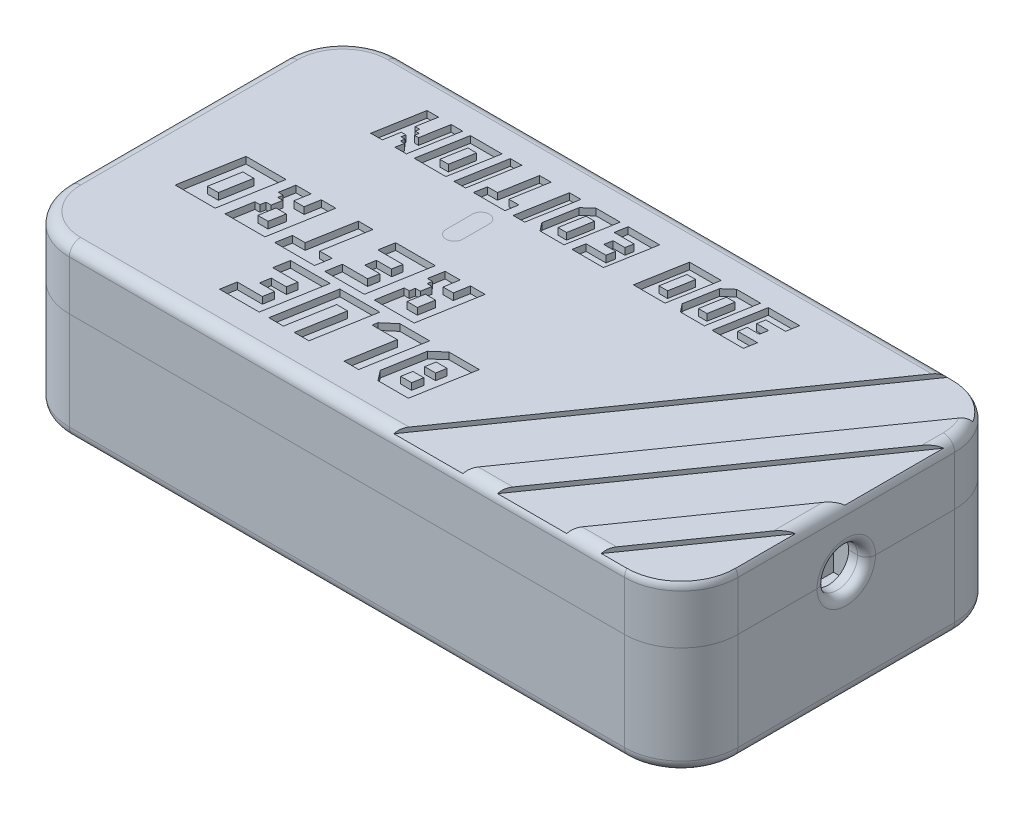
from build123d import *

# Parameters (mm, degrees)
SKETCH1_R                                  = 2
BOSS_EXTRUDE1_DEPTH                        = 0.8
SKETCH2_W                                  = 1.500000048
SKETCH2_H                                  = 4.000000128
BOSS_EXTRUDE2_DEPTH                        = 1
SKETCH3_W                                  = 48.25
SKETCH3_H                                  = 25.72
BOSS_EXTRUDE3_DEPTH                        = 4.15
SKETCH4_W                                  = 4.999999906
SKETCH4_H                                  = 2.000000064
CUT_EXTRUDE1_DEPTH                         = 0.1
SKETCH9_W                                  = 17.77
SKETCH9_H                                  = 15.77
BOSS_EXTRUDE8_DEPTH                        = 3.2
SKETCH23_W                                 = 6.24
SKETCH23_H                                 = 19.54
BOSS_EXTRUDE14_DEPTH                       = 3.32
BOX_SHAPE_DEPTH                            = 6.7945
BOX_SHAPE_DEPTH_BACK                       = 12.250000074
SKETCH5_W                                  = 74.9375
SKETCH5_H                                  = 37.000000128
CORNER_FILLETS_R                           = 6.35
TOP_SHELL_T                                = -2
BOTTOM_SHELL_T                             = -2
PCB_BOSS_HORIZONTAL_DEPTH                  = 1
PCB_BOSS_HORIZONTAL_2_DEPTH                = 1
PCB_BOSS_VERT_PATTERN_1_COUNT              = 2
PCB_BOSS_VERT_PATTERN_1_ANGLE              = 90
PCB_BOSS_VERT_PATTERN_2_COUNT              = 2
PCB_BOSS_VERT_PATTERN_2_ANGLE              = 90
SKETCH7_R                                  = 2.45
SKETCH7_R_2                                = 1.95
PCB_BOSS_EDGE_BREAK_DEPTH                  = 80.071052961
PCB_PCB_TOP_CATCH_REACH                    = 81.319
SKETCH8_R                                  = 3
SKETCH8_R_2                                = 2
BOSS_NOTCH_FOR_ESP32_REACH                 = 79.988
SKETCH10_W                                 = 3.175
SKETCH10_H                                 = 6.35
SHORT_SIDE_SNAP_FIT_FEMALE_DEPTH           = 11.5
SNAP_FIT_FILL_FOR_CORD_HOLE_REACH          = 82.987
SKETCH24_W                                 = 6.35
SKETCH24_H                                 = 3.7011433
LONG_SIDE_SNP_FIT_FEMALE_DEPTH             = 30.46875
SHORT_SIDE_SNAP_FIT_MALE_DEPTH             = 10.5
SHORT_SIDE_SNAP_FIT_MALE_DEPTH_BACK        = 10.5
LONG_SIDE_SNP_FIT_MALE_DEPTH               = 29.46875
LONG_SIDE_SNP_FIT_MALE_DEPTH_BACK          = 29.46875
SKETCH15_R                                 = 2.275
CORD_HOLE_CUT_DEPTH                        = 2
SNAPFIT_MALE_REMOVAL_FOR_CORD_HOLE_1_REACH = 81.191
SKETCH25_W                                 = 8.35
SKETCH25_H                                 = 7.7945
SKETCH26_W                                 = 8.35
SKETCH26_H                                 = 2.95
SNAPFIT_MALE_REMOVAL_FOR_CORD_HOLE_2_DEPTH = 81.987291698
CORD_HOLE_FILLET_BOTTOM_R                  = 1
CORD_HOLE_FILLET_TOP_R                     = 1
LED_HOLE_DEPTH                             = 2
TOP_EDGE_FILLET_R                          = 1.27
DIAG_LINES_CUT_DEPTH                       = 0.5
TEXT_CUT_DEPTH                             = 0.75
BOTTOM_EDGE_FILLET_R                       = 1.27
LED_DIFFUSER_MOCK_DEPTH                    = 1


with BuildPart() as part:
    # Sketch1 → Boss-Extrude1 (new, symmetric)
    with BuildSketch(Plane(origin=(0, 0, 0), x_dir=(1, 0, 0), z_dir=(0, 1, 0))):
        with BuildLine():
            Line((2, 0), (61, 0))
            ThreePointArc((61, 0), (62.414213562, 0.585786438), (63, 2))
            Line((63, 2), (63, 27))
            ThreePointArc((63, 27), (62.414213562, 28.414213562), (61, 29))
            Line((61, 29), (2, 29))
            ThreePointArc((2, 29), (0.585786438, 28.414213562), (0, 27))
            Line((0, 27), (0, 2))
            ThreePointArc((0, 2), (0.585786438, 0.585786438), (2, 0))
        make_face()
        with Locations(Location((4, 4, 0), (0, 0, 270))):
            Circle(SKETCH1_R, mode=Mode.SUBTRACT)
        with Locations(Location((4, 25, 0), (0, 0, 270))):
            Circle(SKETCH1_R, mode=Mode.SUBTRACT)
        with Locations(Location((59, 25, 0), (0, 0, 270))):
            Circle(SKETCH1_R, mode=Mode.SUBTRACT)
        with Locations(Location((59, 4, 0), (0, 0, 270))):
            Circle(SKETCH1_R, mode=Mode.SUBTRACT)
    extrude(amount=BOSS_EXTRUDE1_DEPTH, both=True)

    # Sketch2 → Boss-Extrude2 (add)
    with BuildSketch(Plane(origin=(0, 0.8, 0), x_dir=(1, 0, 0), z_dir=(0, 1, 0))):
        with Locations((23, 20)):
            Rectangle(SKETCH2_W, SKETCH2_H)
    extrude(amount=BOSS_EXTRUDE2_DEPTH)

    # Sketch3 → Boss-Extrude3 (add)
    with BuildSketch(Plane.XZ.offset(0.8)):
        with Locations((31, -15)):
            Rectangle(SKETCH3_W, SKETCH3_H)
    extrude(amount=BOSS_EXTRUDE3_DEPTH)

    # Sketch4 → Cut-Extrude1 (cut)
    with BuildSketch(Plane(origin=(0, 0.8, 0), x_dir=(1, 0, 0), z_dir=(0, 1, 0))):
        with Locations((52, 23)):
            Rectangle(SKETCH4_W, SKETCH4_H)
        with Locations((52, 13)):
            Rectangle(SKETCH4_W, SKETCH4_H)
        with Locations((52, 18)):
            Rectangle(SKETCH4_W, SKETCH4_H)
        with Locations((52, 8)):
            Rectangle(SKETCH4_W, SKETCH4_H)
    extrude(amount=-CUT_EXTRUDE1_DEPTH, mode=Mode.SUBTRACT)

    # Sketch9 → Boss-Extrude8 (add)
    with BuildSketch(Plane.XZ.offset(4.95)):
        with Locations((22.76, -15)):
            Rectangle(SKETCH9_W, SKETCH9_H)
    extrude(amount=BOSS_EXTRUDE8_DEPTH)

    # Sketch23 → Boss-Extrude14 (add)
    with BuildSketch(Plane(origin=(0, 0.8, 0), x_dir=(1, 0, 0), z_dir=(0, 1, 0))):
        with Locations((31, 15)):
            Rectangle(SKETCH23_W, SKETCH23_H)
        with Locations((43, 15)):
            Rectangle(SKETCH23_W, SKETCH23_H)
    extrude(amount=BOSS_EXTRUDE14_DEPTH)


with BuildPart() as body_2:
    # Sketch5 → Box Shape (new, two sides: drawn at the far end of the back side and taken through both)
    with BuildSketch(Plane(origin=(0, 0, 0), x_dir=(1, 0, 0), z_dir=(0, 1, 0)).offset(-BOX_SHAPE_DEPTH_BACK)):
        with Locations((33.46875, 14.500000064)):
            Rectangle(SKETCH5_W, SKETCH5_H)
    extrude(amount=BOX_SHAPE_DEPTH + BOX_SHAPE_DEPTH_BACK)

    # Corner Fillets
    corner_fillets_edges = [body_2.edges().sort_by_distance(p)[0] for p in [
        (-4, -2.727750037, -33.000000128),
        (70.9375, -2.727750037, -33.000000128),
        (70.9375, -2.727750037, 4),
        (-4, -2.727750037, 4),
    ]]
    fillet(corner_fillets_edges, radius=CORNER_FILLETS_R)


with BuildPart() as body_3:
    # Top Bottom Split: the piece on the far side of the plane
    add(body_2.part)
    split(bisect_by=Plane.ZX, keep=Keep.BOTTOM)

    # Bottom Shell
    bottom_shell_openings = [body_3.faces().sort_by_distance(p)[0] for p in [
        (33.46875, 0, -14.500000064),
    ]]
    offset(amount=BOTTOM_SHELL_T, openings=bottom_shell_openings, kind=Kind.INTERSECTION)


with BuildPart() as body_2_1:
    add(body_2.part)

    # Top Bottom Split
    split(bisect_by=Plane.ZX, keep=Keep.TOP)

    # Top Shell
    top_shell_openings = [body_2_1.faces().sort_by_distance(p)[0] for p in [
        (33.46875, 0, -14.500000064),
    ]]
    offset(amount=TOP_SHELL_T, openings=top_shell_openings, kind=Kind.INTERSECTION)


with BuildPart() as body_4:
    # Sketch6 → PCB Boss Horizontal (new, symmetric)
    with BuildSketch(Plane.XY.offset(-4.000000128)):
        Polygon((61.75, -0.8), (64.715, -10.250000074), (53.285, -10.250000074), (56.25, -0.8), (57.25, -0.8), (57.25, 3.7945), (60.75, 3.7945), (60.75, -0.8), align=None)
    extrude(amount=PCB_BOSS_HORIZONTAL_DEPTH, both=True)


with BuildPart() as body_5:
    # Sketch6 → PCB Boss Horizontal 2 (new, symmetric)
    with BuildSketch(Plane.XY.offset(-4.000000128)):
        Polygon((2.25, -0.8), (1.25, -0.8), (-1.715, -10.250000074), (9.715, -10.250000074), (6.75, -0.8), (5.75, -0.8), (5.75, 3.7945), (2.25, 3.7945), align=None)
    extrude(amount=PCB_BOSS_HORIZONTAL_2_DEPTH, both=True)


with BuildPart() as pcb_boss_vert_pattern_1_1:
    # PCB Boss Vert Pattern 1: pattern copy
    add(body_4.part.rotate(Axis((59, 0, -4), (0, 1, 0)), 1 * PCB_BOSS_VERT_PATTERN_1_ANGLE / (PCB_BOSS_VERT_PATTERN_1_COUNT - 1)))


with BuildPart() as pcb_boss_vert_pattern_2_1:
    # PCB Boss Vert Pattern 2: pattern copy
    add(body_5.part.rotate(Axis((4, 0, -4), (0, 1, 0)), 1 * PCB_BOSS_VERT_PATTERN_2_ANGLE / (PCB_BOSS_VERT_PATTERN_2_COUNT - 1)))


with BuildPart() as body_8:
    # PCB Boss Mirror 1: read off the stored shape, not the designer's step
    # PCB Boss Mirror 1: mirrored copy
    add(pcb_boss_vert_pattern_2_1.part.mirror(Plane.XY.offset(-14.5)))


with BuildPart() as body_9:
    # PCB Boss Mirror 1 2: mirrored copy
    add(body_5.part.mirror(Plane.XY.offset(-14.5)))


with BuildPart() as body_10:
    # PCB Boss Mirror 2: mirrored copy
    add(body_4.part.mirror(Plane(origin=(0, 0, -14.5), x_dir=(1, 0, 0), z_dir=(0, 0, -1))))


with BuildPart() as body_11:
    # PCB Boss Mirror 2 2: mirrored copy
    add(pcb_boss_vert_pattern_1_1.part.mirror(Plane(origin=(0, 0, -14.5), x_dir=(1, 0, 0), z_dir=(0, 0, -1))))


with BuildPart() as body_4_1:
    add(body_4.part)

    # Bottom Combine: union body 5, PCB Boss Vert Pattern 2_1, PCB Boss Vert Pattern 1_1, body 3, body 9, body 8, body 11, body 10
    add(body_5.part)
    add(pcb_boss_vert_pattern_2_1.part)
    add(pcb_boss_vert_pattern_1_1.part)
    add(body_3.part)
    add(body_9.part)
    add(body_8.part)
    add(body_11.part)
    add(body_10.part)

    # Sketch7 → PCB Boss Edge Break (cut, through all)
    # profile 1 of 4: a face of its own
    with BuildSketch(Plane(origin=(0, -0.8, 0), x_dir=(1, 0, 0), z_dir=(0, 1, 0))):
        with Locations((59, 25)):
            Circle(SKETCH7_R)
        with Locations((59, 25)):
            Circle(SKETCH7_R_2, mode=Mode.SUBTRACT)
    # profile 2 of 4: a face of its own
    with BuildSketch(Plane(origin=(0, -0.8, 0), x_dir=(1, 0, 0), z_dir=(0, 1, 0))):
        with Locations((59, 4)):
            Circle(SKETCH7_R)
        with Locations((59, 4)):
            Circle(SKETCH7_R_2, mode=Mode.SUBTRACT)
    # profile 3 of 4: a face of its own
    with BuildSketch(Plane(origin=(0, -0.8, 0), x_dir=(1, 0, 0), z_dir=(0, 1, 0))):
        with Locations((4, 4)):
            Circle(SKETCH7_R)
        with Locations((4, 4)):
            Circle(SKETCH7_R_2, mode=Mode.SUBTRACT)
    # profile 4 of 4: a face of its own
    with BuildSketch(Plane(origin=(0, -0.8, 0), x_dir=(1, 0, 0), z_dir=(0, 1, 0))):
        with Locations((4, 25)):
            Circle(SKETCH7_R)
        with Locations((4, 25)):
            Circle(SKETCH7_R_2, mode=Mode.SUBTRACT)
    extrude(amount=PCB_BOSS_EDGE_BREAK_DEPTH, mode=Mode.SUBTRACT)

    # Boss Notch for ESP32: up to this face of the body (flat: up to its plane)
    boss_notch_for_esp32_end = Plane(body_4_1.part.faces().sort_by_distance((6.601382843, -5.53442938, -25.999999872))[0])
    # Sketch10 → Boss Notch for ESP32 (cut, up to the picked face)
    with BuildSketch(Plane.XY.offset(-3.000000128), mode=Mode.PRIVATE) as boss_notch_for_esp32_sk1:
        with Locations((54.5375, -2.775)):
            Rectangle(SKETCH10_W, SKETCH10_H)
    boss_notch_for_esp32_tool1 = split(extrude(boss_notch_for_esp32_sk1.sketch, amount=-BOSS_NOTCH_FOR_ESP32_REACH, mode=Mode.PRIVATE), bisect_by=boss_notch_for_esp32_end, keep=Keep.BOTH, mode=Mode.PRIVATE)
    # Sketch10 → Boss Notch for ESP32 (cut, up to the picked face)
    with BuildSketch(Plane.XY.offset(-3.000000128), mode=Mode.PRIVATE) as boss_notch_for_esp32_sk2:
        with Locations((7.4625, -2.775)):
            Rectangle(SKETCH10_W, SKETCH10_H)
    boss_notch_for_esp32_tool2 = split(extrude(boss_notch_for_esp32_sk2.sketch, amount=-BOSS_NOTCH_FOR_ESP32_REACH, mode=Mode.PRIVATE), bisect_by=boss_notch_for_esp32_end, keep=Keep.BOTH, mode=Mode.PRIVATE)
    add(boss_notch_for_esp32_tool1.solids().sort_by(Axis((54.5375, -2.775, -3), (0, 0, -1)))[0], mode=Mode.SUBTRACT)
    add(boss_notch_for_esp32_tool2.solids().sort_by(Axis((7.4625, -2.775, -3), (0, 0, -1)))[0], mode=Mode.SUBTRACT)

    # Sketch11 → Short Side Snap Fit Female (cut, symmetric)
    with BuildSketch(Plane(origin=(0, 0, -14.500000064), x_dir=(-1, 0, 0), z_dir=(0, 0, -1))):
        with BuildLine():
            Line((-68.9375, 0), (-68.9375, -3))
            Line((-68.9375, -3), (-69.1875, -3))
            ThreePointArc((-69.1875, -3), (-69.937242994, -2.269632711), (-69.226751967, -1.501027849))
            Line((-69.226751967, -1.501027849), (-69.305417503, 0))
            Line((-69.305417503, 0), (-68.9375, 0))
        make_face()
    short_side_snap_fit_female = extrude(amount=SHORT_SIDE_SNAP_FIT_FEMALE_DEPTH, both=True, mode=Mode.SUBTRACT)

    # Snap Fit Fill for Cord Hole: up to this face of the body (flat: up to its plane)
    snap_fit_fill_for_cord_hole_end = Plane(body_4_1.part.faces().sort_by_distance((70.9375, -6.125000037, -14.500000064))[0])
    # Sketch24 → Snap Fit Fill for Cord Hole (add, up to the picked face)
    with BuildSketch(Plane.ZY.offset(-68.9375), mode=Mode.PRIVATE) as snap_fit_fill_for_cord_hole_sk1:
        with Locations((-14.500000064, -1.85057165)):
            Rectangle(SKETCH24_W, SKETCH24_H)
    snap_fit_fill_for_cord_hole_tool1 = split(extrude(snap_fit_fill_for_cord_hole_sk1.sketch, amount=-SNAP_FIT_FILL_FOR_CORD_HOLE_REACH, mode=Mode.PRIVATE), bisect_by=snap_fit_fill_for_cord_hole_end, keep=Keep.BOTH, mode=Mode.PRIVATE)
    add(snap_fit_fill_for_cord_hole_tool1.solids().sort_by(Axis((68.9375, -1.850572, -14.5), (1, 0, 0)))[0])

    # Short Side Snp Fit Female Mirror: Short Side Snap Fit Female across plane
    add(short_side_snap_fit_female.mirror(Plane.ZY.offset(-33.46875)), mode=Mode.SUBTRACT)

    # Sketch12 → Long Side Snp Fit Female (cut, symmetric)
    with BuildSketch(Plane.ZY.offset(-33.46875)):
        with BuildLine():
            Line((2.367449648, 0), (2, 0))
            Line((2, 0), (2, -3))
            Line((2, -3), (2.25, -3))
            ThreePointArc((2.25, -3), (2.999749072, -2.269399183), (2.288785386, -1.501003542))
            Line((2.288785386, -1.501003542), (2.367449648, 0))
        make_face()
    long_side_snp_fit_female = extrude(amount=LONG_SIDE_SNP_FIT_FEMALE_DEPTH, both=True, mode=Mode.SUBTRACT)

    # Long Side Snp Fit Female Mirror: Long Side Snp Fit Female across plane
    add(long_side_snp_fit_female.mirror(Plane(origin=(0, 0, -14.500000064), x_dir=(1, 0, 0), z_dir=(0, 0, -1))), mode=Mode.SUBTRACT)


with BuildPart() as body_4_2:

    # Sketch8 → PCB PCB Top Catch (new, up to next)
    with BuildSketch(Plane(origin=(0, 0.8, 0), x_dir=(1, 0, 0), z_dir=(0, 1, 0)), mode=Mode.PRIVATE) as pcb_pcb_top_catch_sk1:
        with Locations(Location((59, 4, 0), (0, 0, 90))):
            Circle(SKETCH8_R)
        with Locations(Location((59, 4, 0), (0, 0, 270))):
            Circle(SKETCH8_R_2, mode=Mode.SUBTRACT)
    pcb_pcb_top_catch_tool1 = extrude(pcb_pcb_top_catch_sk1.sketch, amount=PCB_PCB_TOP_CATCH_REACH, mode=Mode.PRIVATE) - body_2_1.part
    # Sketch8 → PCB PCB Top Catch (new, up to next)
    with BuildSketch(Plane(origin=(0, 0.8, 0), x_dir=(1, 0, 0), z_dir=(0, 1, 0)), mode=Mode.PRIVATE) as pcb_pcb_top_catch_sk2:
        with Locations(Location((59, 25, 0), (0, 0, 90))):
            Circle(SKETCH8_R)
        with Locations(Location((59, 25, 0), (0, 0, 270))):
            Circle(SKETCH8_R_2, mode=Mode.SUBTRACT)
    pcb_pcb_top_catch_tool2 = extrude(pcb_pcb_top_catch_sk2.sketch, amount=PCB_PCB_TOP_CATCH_REACH, mode=Mode.PRIVATE) - body_2_1.part
    # Sketch8 → PCB PCB Top Catch (new, up to next)
    with BuildSketch(Plane(origin=(0, 0.8, 0), x_dir=(1, 0, 0), z_dir=(0, 1, 0)), mode=Mode.PRIVATE) as pcb_pcb_top_catch_sk3:
        with Locations(Location((4, 25, 0), (0, 0, 90))):
            Circle(SKETCH8_R)
        with Locations(Location((4, 25, 0), (0, 0, 270))):
            Circle(SKETCH8_R_2, mode=Mode.SUBTRACT)
    pcb_pcb_top_catch_tool3 = extrude(pcb_pcb_top_catch_sk3.sketch, amount=PCB_PCB_TOP_CATCH_REACH, mode=Mode.PRIVATE) - body_2_1.part
    # Sketch8 → PCB PCB Top Catch (new, up to next)
    with BuildSketch(Plane(origin=(0, 0.8, 0), x_dir=(1, 0, 0), z_dir=(0, 1, 0)), mode=Mode.PRIVATE) as pcb_pcb_top_catch_sk4:
        with Locations(Location((4, 4, 0), (0, 0, 90))):
            Circle(SKETCH8_R)
        with Locations(Location((4, 4, 0), (0, 0, 270))):
            Circle(SKETCH8_R_2, mode=Mode.SUBTRACT)
    pcb_pcb_top_catch_tool4 = extrude(pcb_pcb_top_catch_sk4.sketch, amount=PCB_PCB_TOP_CATCH_REACH, mode=Mode.PRIVATE) - body_2_1.part
    add(pcb_pcb_top_catch_tool1.solids().sort_by_distance((59, 0.8, -1.084853))[0])
    add(pcb_pcb_top_catch_tool2.solids().sort_by_distance((59, 0.8, -22.084853))[0])
    add(pcb_pcb_top_catch_tool3.solids().sort_by_distance((4, 0.8, -22.084853))[0])
    add(pcb_pcb_top_catch_tool4.solids().sort_by_distance((4, 0.8, -1.084853))[0])


with BuildPart() as body_2_2:
    add(body_2_1.part)

    # Top Combine: read off the stored shape, not the designer's step
    # Top Combine: union body 4 2
    add(body_4_2.part)


with BuildPart() as body_4_3:
    # Sketch13 → Short Side Snap fit Male (new, two sides: drawn at the far end of the back side and taken through both)
    with BuildSketch(Plane(origin=(0, 0, -14.500000064), x_dir=(-1, 0, 0), z_dir=(0, 0, -1)).offset(-SHORT_SIDE_SNAP_FIT_MALE_DEPTH_BACK)):
        with BuildLine():
            Line((-67.255486027, 4.7945), (-69.255486027, 4.7945))
            Line((-69.255486027, 4.7945), (-69.255486027, 0.002616798))
            Line((-69.255486027, 0.002616798), (-69.174110116, -1.550128075))
            ThreePointArc((-69.174110116, -1.550128075), (-69.88746798, -2.243304752), (-69.1875, -2.95))
            Line((-69.1875, -2.95), (-67.9175, -2.95))
            Line((-67.9175, -2.95), (-67.255486027, 4.7945))
        make_face()
    extrude(amount=SHORT_SIDE_SNAP_FIT_MALE_DEPTH + SHORT_SIDE_SNAP_FIT_MALE_DEPTH_BACK)


with BuildPart() as body_5_2:
    # Short Side Snap fit Male Mirror: mirrored copy
    add(body_4_3.part.mirror(Plane.ZY.offset(-33.46875)))


with BuildPart() as body_6:
    # Sketch14 → Long Side Snp Fit Male (new, two sides: drawn at the far end of the back side and taken through both)
    with BuildSketch(Plane.ZY.offset(-33.46875).offset(-LONG_SIDE_SNP_FIT_MALE_DEPTH_BACK)):
        with BuildLine():
            Line((0.98, -2.95), (0.317518107, 4.7945))
            Line((0.317518107, 4.7945), (2.317518171, 4.7945))
            Line((2.317518171, 4.7945), (2.317518171, 0.002616798))
            Line((2.317518171, 0.002616798), (2.236141783, -1.550137192))
            ThreePointArc((2.236141783, -1.550137192), (2.949965701, -2.243070552), (2.25, -2.95))
            Line((2.25, -2.95), (0.98, -2.95))
        make_face()
    extrude(amount=LONG_SIDE_SNP_FIT_MALE_DEPTH + LONG_SIDE_SNP_FIT_MALE_DEPTH_BACK)


with BuildPart() as body_7:
    # Long Side Snp Fit Male Mirror: mirrored copy
    add(body_6.part.mirror(Plane(origin=(0, 0, -14.500000064), x_dir=(1, 0, 0), z_dir=(0, 0, -1))))


with BuildPart() as body_6_1:
    add(body_6.part)

    # Top Combine 2: union body 5 2, body 4 3, body 2, body 7
    add(body_5_2.part)
    add(body_4_3.part)
    add(body_2_2.part)
    add(body_7.part)


with BuildPart() as cord_hole_cut_tool:
    # Sketch15 → Cord Hole Cut (new body)
    with BuildSketch(Plane(origin=(70.9375, 0, 37.937499872), x_dir=(0, 0, 1), z_dir=(-1, 0, 0))):
        with Locations(Location((-52.437499936, 0, 0), (0, 0, 180))):
            Circle(SKETCH15_R)
    extrude(amount=CORD_HOLE_CUT_DEPTH)


with BuildPart() as body_4_4:
    add(body_4_1.part)

    # Cord Hole Cut: cut by cord_hole_cut_tool
    add(cord_hole_cut_tool.part, mode=Mode.SUBTRACT)

    # Cord Hole Fillet Bottom
    cord_hole_fillet_bottom_edges = [body_4_4.edges().sort_by_distance(p)[0] for p in [
        (70.9375, -2.275, -14.500000064),
    ]]
    fillet(cord_hole_fillet_bottom_edges, radius=CORD_HOLE_FILLET_BOTTOM_R)

    # Bottom Edge Fillet
    bottom_edge_fillet_edges = [body_4_4.edges().sort_by_distance(p)[0] for p in [
        (-4, -12.250000074, -14.500000064),
        (-2.140128061, -12.250000074, -31.140128189),
        (69.077628061, -12.250000074, -31.140128189),
        (69.077628061, -12.250000074, 2.140128061),
        (-2.140128061, -12.250000074, 2.140128061),
        (33.46875, -12.250000074, 4),
        (70.9375, -12.250000074, -14.500000064),
        (33.46875, -12.250000074, -33.000000128),
    ]]
    fillet(bottom_edge_fillet_edges, radius=BOTTOM_EDGE_FILLET_R)


with BuildPart() as body_6_2:
    add(body_6_1.part)

    # Cord Hole Cut: cut by cord_hole_cut_tool
    add(cord_hole_cut_tool.part, mode=Mode.SUBTRACT)

    # Snapfit Male Removal for Cord Hole 1: up to this face of the body (flat: up to its plane)
    snapfit_male_removal_for_cord_hole_1_end = Plane(body_6_2.part.faces().sort_by_distance((68.9375, 2.39725, -3.175000032))[0])
    # Sketch25 → Snapfit Male Removal for Cord Hole 1 (cut, up to the picked face)
    with BuildSketch(Plane.ZY, mode=Mode.PRIVATE) as snapfit_male_removal_for_cord_hole_1_sk1:
        with Locations((-14.500000064, 0.89725)):
            Rectangle(SKETCH25_W, SKETCH25_H)
    snapfit_male_removal_for_cord_hole_1_tool1 = split(extrude(snapfit_male_removal_for_cord_hole_1_sk1.sketch, amount=-SNAPFIT_MALE_REMOVAL_FOR_CORD_HOLE_1_REACH, mode=Mode.PRIVATE), bisect_by=snapfit_male_removal_for_cord_hole_1_end, keep=Keep.BOTH, mode=Mode.PRIVATE)
    add(snapfit_male_removal_for_cord_hole_1_tool1.solids().sort_by(Axis((0, 0.89725, -14.5), (1, 0, 0)))[0], mode=Mode.SUBTRACT)

    # Sketch26 → Snapfit Male Removal for Cord Hole 2 (cut, through all)
    with BuildSketch(Plane.ZY.offset(-68.9375)):
        with Locations((-14.500000064, -1.475)):
            Rectangle(SKETCH26_W, SKETCH26_H)
    extrude(amount=-SNAPFIT_MALE_REMOVAL_FOR_CORD_HOLE_2_DEPTH, mode=Mode.SUBTRACT)

    # Cord Hole Fillet Top
    cord_hole_fillet_top_edges = [body_6_2.edges().sort_by_distance(p)[0] for p in [
        (70.9375, 2.275, -14.500000064),
    ]]
    fillet(cord_hole_fillet_top_edges, radius=CORD_HOLE_FILLET_TOP_R)

    # Sketch18 → LED Hole (cut)
    with BuildSketch(Plane(origin=(0, 6.7945, 0), x_dir=(1, 0, 0), z_dir=(0, 1, 0))):
        with BuildLine():
            Line((23.947187834, 21.478545696), (23.947187834, 18.521454304))
            ThreePointArc((23.947187834, 18.521454304), (23, 17.57426647), (22.052812166, 18.521454304))
            Line((22.052812166, 18.521454304), (22.052812166, 21.478545696))
            ThreePointArc((22.052812166, 21.478545696), (23, 22.42573353), (23.947187834, 21.478545696))
        make_face()
    extrude(amount=-LED_HOLE_DEPTH, mode=Mode.SUBTRACT)

    # Top Edge Fillet
    top_edge_fillet_edges = [body_6_2.edges().sort_by_distance(p)[0] for p in [
        (33.46875, 6.7945, -33.000000128),
        (-2.140128061, 6.7945, -31.140128189),
        (-4, 6.7945, -14.500000064),
        (-2.140128061, 6.7945, 2.140128061),
        (33.46875, 6.7945, 4),
        (69.077628061, 6.7945, 2.140128061),
        (70.9375, 6.7945, -14.500000064),
        (69.077628061, 6.7945, -31.140128189),
    ]]
    fillet(top_edge_fillet_edges, radius=TOP_EDGE_FILLET_R)

    # Sketch19 → Diag Lines Cut (cut)
    with BuildSketch(Plane(origin=(0, 6.7945, 0), x_dir=(1, 0, 0), z_dir=(0, 1, 0))):
        with BuildLine():
            Line((46.038104632, -4), (69.916927185, 30.102492833))
            ThreePointArc((69.916927185, 30.102492833), (67.442123924, 32.322179802), (64.184920338, 32.987225831))
            Line((64.184920338, 32.987225831), (38.286185994, -4))
            Line((38.286185994, -4), (46.038104632, -4))
        make_face()
        Polygon((70.9375, 26.024578288), (49.914063952, -4), (57.66598259, -4), (70.9375, 14.953691135), align=None)
        Polygon((70.9375, -1.652639593), (69.293860548, -4), (61.541941909, -4), (70.9375, 9.418247559), align=None)
    extrude(amount=-DIAG_LINES_CUT_DEPTH, mode=Mode.SUBTRACT)

    # Sketch20 → Text Cut (cut)
    # profile 1 of 19: a face of its own
    with BuildSketch(Plane(origin=(0, 6.7945, 0), x_dir=(1, 0, 0), z_dir=(0, 1, 0))):
        Polygon((16.054553203, 5.090141256), (18.868877577, 5.090141256), (18.676582969, 3.999550936), (16.987988344, 3.999550936), (16.790514926, 2.87958607), (18.479109551, 2.87958607), (18.273768787, 1.715002179), (15.459444412, 1.715002179), (15.161267449, 0.023899851), (19.608688003, 0.023899851), (20.801067959, 6.786446359), (16.353647405, 6.786446359), align=None)
    # profile 2 of 19: a face of its own
    with BuildSketch(Plane(origin=(0, 6.7945, 0), x_dir=(1, 0, 0), z_dir=(0, 1, 0))):
        Polygon((22.327551478, 0.017205745), (23.222475626, 5.092742644), (24.445065666, 5.092742644), (23.550141518, 0.017205745), (25.183237697, 0.017205745), (26.376338808, 6.783844971), (21.887556411, 6.783844971), (20.694455299, 0.017205745), align=None)
    # profile 3 of 19: a face of its own
    with BuildSketch(Plane(origin=(0, 6.7945, 0), x_dir=(1, 0, 0), z_dir=(0, 1, 0))):
        Polygon((27.297546557, 5.653006131), (27.198301662, 5.090141256), (30.020336515, 5.090141256), (29.125870986, 0.017205745), (30.758967166, 0.017205745), (31.952526897, 6.786446359), (28.623125615, 6.786446359), align=None)
    # profile 4 of 19: a face of its own
    with BuildSketch(Plane(origin=(0, 6.7945, 0), x_dir=(1, 0, 0), z_dir=(0, 1, 0))):
        Polygon((32.840231432, 5.656449593), (32.045125181, 1.147028214), (32.490246769, 0.584163339), (32.482790111, 0.584163339), (32.935367267, 0.021298464), (36.335417789, 0.021298464), (37.527797745, 6.783844971), (34.127747223, 6.783844971), align=None)
        Polygon((35.403771374, 3.999550936), (34.181181335, 3.999550936), (34.373934564, 5.092742644), (35.596524603, 5.092742644), align=None, mode=Mode.SUBTRACT)
        Polygon((33.983707917, 2.87958607), (35.206297956, 2.87958607), (35.001415813, 1.717603566), (33.778825774, 1.717603566), align=None, mode=Mode.SUBTRACT)
    # profile 5 of 19: a face of its own
    with BuildSketch(Plane(origin=(0, 6.7945, 0), x_dir=(1, 0, 0), z_dir=(0, 1, 0))):
        Polygon((7.05178874, 7.643899851), (8.243710076, 14.403844971), (3.754927679, 14.403844971), (2.563006342, 7.643899851), align=None)
        Polygon((5.716869524, 9.335002179), (4.494279485, 9.335002179), (5.089846895, 12.712742644), (6.312436934, 12.712742644), align=None, mode=Mode.SUBTRACT)
    # profile 6 of 19: a face of its own
    with BuildSketch(Plane(origin=(0, 6.7945, 0), x_dir=(1, 0, 0), z_dir=(0, 1, 0))):
        Polygon((12.627518209, 7.643899851), (13.819439545, 14.403844971), (12.186343366, 14.403844971), (11.896820265, 12.761825859), (10.745622408, 12.761825859), (11.035145509, 14.403844971), (9.347202321, 14.403844971), (9.049025357, 12.712742644), (9.611890232, 12.712742644), (9.520696785, 12.195542578), (10.083561659, 12.195542578), (9.886601329, 11.078490656), (9.323736454, 11.078490656), (9.221749645, 10.500075191), (8.65888477, 10.500075191), (8.155280984, 7.643899851), align=None)
        Polygon((11.598643301, 11.070723531), (11.292598993, 9.335002179), (10.141401136, 9.335002179), (10.447445445, 11.070723531), align=None, mode=Mode.SUBTRACT)
    # profile 7 of 19: a face of its own
    with BuildSketch(Plane(origin=(0, 6.7945, 0), x_dir=(1, 0, 0), z_dir=(0, 1, 0))):
        Polygon((13.731290418, 7.643899851), (18.186422539, 7.643899851), (18.484599502, 9.335002179), (17.073582076, 9.335002179), (17.968506224, 14.410539078), (16.335408955, 14.410539078), (15.440484807, 9.335002179), (14.029467381, 9.335002179), align=None)
    # profile 8 of 19: a face of its own
    with BuildSketch(Plane(origin=(0, 6.7945, 0), x_dir=(1, 0, 0), z_dir=(0, 1, 0))):
        Polygon((20.224842345, 12.710141256), (23.03916672, 12.710141256), (22.846872111, 11.619550936), (21.158277486, 11.619550936), (20.960804068, 10.49958607), (22.649398693, 10.49958607), (22.44405793, 9.335002179), (19.629733555, 9.335002179), (19.331556592, 7.643899851), (23.778977146, 7.643899851), (24.971357102, 14.406446359), (20.523936548, 14.406446359), align=None)
    # profile 9 of 19: a face of its own
    with BuildSketch(Plane(origin=(0, 6.7945, 0), x_dir=(1, 0, 0), z_dir=(0, 1, 0))):
        Polygon((29.354706614, 7.643899851), (30.546627951, 14.403844971), (28.913531772, 14.403844971), (28.62400867, 12.761825859), (27.472810814, 12.761825859), (27.762333915, 14.403844971), (26.074390726, 14.403844971), (25.776213763, 12.712742644), (26.339078638, 12.712742644), (26.24788519, 12.195542578), (26.810750065, 12.195542578), (26.613789735, 11.078490656), (26.05092486, 11.078490656), (25.948938051, 10.500075191), (25.386073176, 10.500075191), (24.88246939, 7.643899851), align=None)
        Polygon((28.325831707, 11.070723531), (28.019787399, 9.335002179), (26.868589542, 9.335002179), (27.17463385, 11.070723531), align=None, mode=Mode.SUBTRACT)
    # profile 10 of 19: a face of its own
    with BuildSketch(Plane(origin=(0, 6.7945, 0), x_dir=(1, 0, 0), z_dir=(0, 1, 0))):
        Polygon((50.271455005, 23.637486284), (50.508237916, 24.98039449), (48.292439375, 24.98039449), (48.454637739, 25.900297305), (49.791441817, 25.900297305), (49.947774939, 26.786936157), (48.610970861, 26.786936157), (48.763567167, 27.652379593), (50.979365708, 27.652379593), (51.21542247, 28.991168936), (47.706756121, 28.991168936), (46.762788656, 23.637486284), align=None)
    # profile 11 of 19: a face of its own
    with BuildSketch(Plane(origin=(0, 6.7945, 0), x_dir=(1, 0, 0), z_dir=(0, 1, 0))):
        Polygon((43.135266359, 28.098647594), (42.506883529, 24.534793131), (43.210582228, 23.637486284), (45.902288892, 23.637486284), (46.846256357, 28.991168936), (44.154549693, 28.991168936), align=None)
        Polygon((44.846203994, 24.98039449), (43.878320213, 24.98039449), (44.349448005, 27.652379593), (45.317331786, 27.652379593), align=None, mode=Mode.SUBTRACT)
    # profile 12 of 19: a face of its own
    with BuildSketch(Plane(origin=(0, 6.7945, 0), x_dir=(1, 0, 0), z_dir=(0, 1, 0))):
        Polygon((41.488532803, 23.639545715), (42.432137194, 28.991168936), (38.878517796, 28.991168936), (37.934913405, 23.639545715), align=None)
        Polygon((40.431721757, 24.978335058), (39.463837976, 24.978335058), (39.935328842, 27.652379593), (40.903212623, 27.652379593), align=None, mode=Mode.SUBTRACT)
    # profile 13 of 19: a face of its own
    with BuildSketch(Plane(origin=(0, 6.7945, 0), x_dir=(1, 0, 0), z_dir=(0, 1, 0))):
        Polygon((31.768244011, 27.650320161), (33.996250808, 27.650320161), (33.844017576, 26.786936157), (32.507213498, 26.786936157), (32.350880375, 25.900297305), (33.687684454, 25.900297305), (33.525123016, 24.978335058), (31.297116219, 24.978335058), (31.061059457, 23.639545715), (34.581934062, 23.639545715), (35.525901527, 28.993228368), (32.005026922, 28.993228368), align=None)
    # profile 14 of 19: a face of its own
    with BuildSketch(Plane(origin=(0, 6.7945, 0), x_dir=(1, 0, 0), z_dir=(0, 1, 0))):
        Polygon((27.400429292, 28.098647594), (26.772046463, 24.534793131), (27.475745162, 23.637486284), (30.167451825, 23.637486284), (31.111419291, 28.991168936), (28.419712627, 28.991168936), align=None)
        Polygon((29.111366927, 24.98039449), (28.143483146, 24.98039449), (28.614610938, 27.652379593), (29.582494719, 27.652379593), align=None, mode=Mode.SUBTRACT)
    # profile 15 of 19: a face of its own
    with BuildSketch(Plane(origin=(0, 6.7945, 0), x_dir=(1, 0, 0), z_dir=(0, 1, 0))):
        Polygon((25.752761748, 23.634246214), (26.698234116, 28.996468437), (25.405366308, 28.996468437), (24.45989394, 23.634246214), align=None)
    # profile 16 of 19: a face of its own
    with BuildSketch(Plane(origin=(0, 6.7945, 0), x_dir=(1, 0, 0), z_dir=(0, 1, 0))):
        Polygon((20.003510718, 23.639545715), (23.530490314, 23.639545715), (23.766547076, 24.978335058), (22.649491614, 24.978335058), (23.357973231, 28.996468437), (22.06510456, 28.996468437), (21.356622943, 24.978335058), (20.23956748, 24.978335058), align=None)
    # profile 17 of 19: a face of its own
    with BuildSketch(Plane(origin=(0, 6.7945, 0), x_dir=(1, 0, 0), z_dir=(0, 1, 0))):
        Polygon((19.128757064, 23.634246214), (20.074229432, 28.996468437), (18.781361623, 28.996468437), (17.835889255, 23.634246214), align=None)
    # profile 18 of 19: a face of its own
    with BuildSketch(Plane(origin=(0, 6.7945, 0), x_dir=(1, 0, 0), z_dir=(0, 1, 0))):
        Polygon((16.91980553, 23.639545715), (17.863409921, 28.991168936), (14.309790523, 28.991168936), (13.366186132, 23.639545715), align=None)
        Polygon((15.862994484, 24.978335058), (14.895110703, 24.978335058), (15.366601569, 27.652379593), (16.33448535, 27.652379593), align=None, mode=Mode.SUBTRACT)
    # profile 19 of 19: a face of its own
    with BuildSketch(Plane(origin=(0, 6.7945, 0), x_dir=(1, 0, 0), z_dir=(0, 1, 0))):
        Polygon((9.792942108, 23.640431409), (10.111277828, 25.445864881), (10.627010256, 25.445864881), (10.546651883, 24.990113835), (10.991738385, 24.990113835), (10.91305136, 24.543845834), (11.372265839, 24.543845834), (11.211884571, 23.634246214), (12.504752379, 23.634246214), (13.450224747, 28.996468437), (12.157356939, 28.996468437), (11.608322602, 25.882636039), (11.149108122, 25.882636039), (11.229234507, 26.3370676), (10.784148006, 26.3370676), (10.860505665, 26.770127813), (10.344773237, 26.770127813), (10.73732353, 28.996468437), (9.444454859, 28.996468437), (8.49898249, 23.634246214), align=None)
    extrude(amount=-TEXT_CUT_DEPTH, mode=Mode.SUBTRACT)


with BuildPart() as body_4_4_1:
    # Sketch22 → LED Diffuser Mock (new body)
    with BuildSketch(Plane(origin=(0, 6.7945, 0), x_dir=(1, 0, 0), z_dir=(0, 1, 0))):
        with BuildLine():
            Line((22.052812166, 21.478545696), (22.052812166, 18.521454304))
            ThreePointArc((22.052812166, 18.521454304), (23, 17.57426647), (23.947187834, 18.521454304))
            Line((23.947187834, 18.521454304), (23.947187834, 21.478545696))
            ThreePointArc((23.947187834, 21.478545696), (23, 22.42573353), (22.052812166, 21.478545696))
        make_face()
    extrude(amount=-LED_DIFFUSER_MOCK_DEPTH)


solid = Compound([part.part, body_4_4.part, body_6_2.part, body_4_4_1.part])
